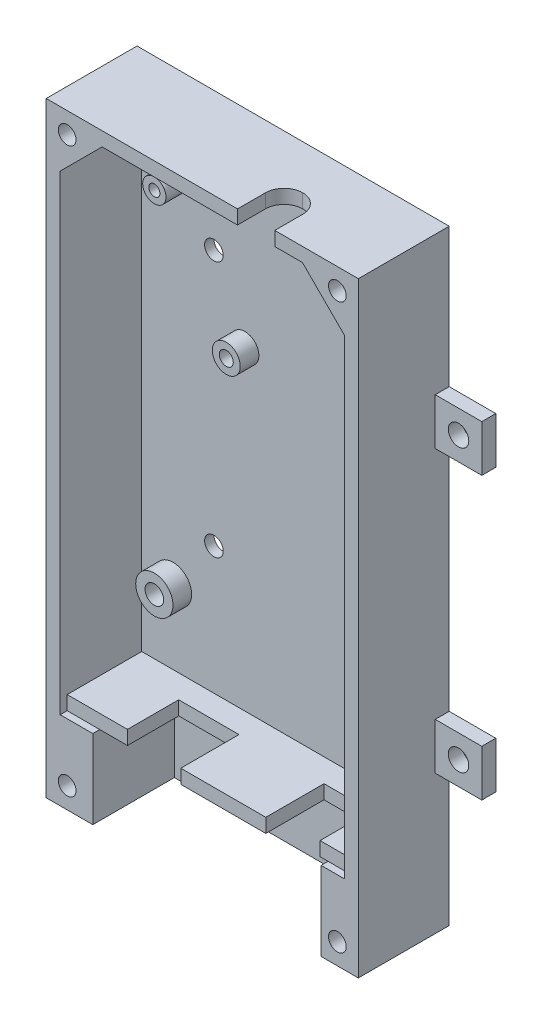
from build123d import *

# Parameters (mm, degrees)
SKETCH1_W           = 67
SKETCH1_H           = 130
BOSS_EXTRUDE1_DEPTH = 2
SKETCH2_W           = 18.2532
SKETCH2_H           = 3
BOSS_EXTRUDE2_DEPTH = 17.5
SKETCH3_R           = 3
SKETCH3_R_2         = 1.5
SKETCH3_R_3         = 2.5
SKETCH3_R_4         = 1.2
SKETCH3_R_5         = 4
SKETCH3_R_6         = 2
BOSS_EXTRUDE3_DEPTH = 4
SKETCH4_W           = 12.938
SKETCH4_H           = 3
SKETCH4_W_2         = 10.144
BOSS_EXTRUDE4_DEPTH = 5
SKETCH5_R           = 2
CUT_EXTRUDE1_DEPTH  = 201.297076365
SKETCH6_W           = 12.940950003
SKETCH6_H           = 3
CUT_EXTRUDE2_DEPTH  = 1.5
SKETCH7_W           = 10
SKETCH7_H           = 16.939031541
SKETCH7_W_2         = 8
BOSS_EXTRUDE5_DEPTH = 17.5
SKETCH8_W           = 6.723849997
SKETCH8_H           = 3
CUT_EXTRUDE3_DEPTH  = 1.5
CHAMFER1_SIZE       = 9
SKETCH10_R          = 1.9
CUT_EXTRUDE4_DEPTH  = 201.481716873
SKETCH11_R          = 2
CUT_EXTRUDE5_DEPTH  = 201.297076365
SKETCH13_W          = 8
SKETCH13_H          = 3
CUT_EXTRUDE6_DEPTH  = 10
FILLET1_R           = 4
SKETCH14_W          = 10
SKETCH14_H          = 10
SKETCH14_R          = 2.2
BOSS_EXTRUDE6_DEPTH = 3
SKETCH15_R          = 1.2
SKETCH15_R_2        = 1.5
CUT_EXTRUDE7_DEPTH  = 203.281693166


with BuildPart() as part:
    # Sketch1 → Boss-Extrude1 (new body)
    with BuildSketch(Plane.XY):
        with Locations((1.448229487, -131.44665957)):
            Rectangle(SKETCH1_W, SKETCH1_H)
    extrude(amount=-BOSS_EXTRUDE1_DEPTH)

    # Sketch2 → Boss-Extrude2 (add)
    with BuildSketch(Plane.XY):
        Polygon((-32.051770513, -66.44665957), (34.948229487, -66.44665957), (34.948229487, -179.507628029), (25.22437949, -179.507628029), (25.22437949, -176.507628029), (31.948229487, -176.507628029), (31.948229487, -69.44665957), (-29.051770513, -69.44665957), (-29.051770513, -176.507628029), (-16.11082051, -176.507628029), (-16.11082051, -179.507628029), (-32.051770513, -179.507628029), align=None)
        with Locations((5.95377949, -178.007628029)):
            Rectangle(SKETCH2_W, SKETCH2_H)
    extrude(amount=BOSS_EXTRUDE2_DEPTH)

    # Sketch3 → Boss-Extrude3 (add)
    # profile 1 of 5: a face of its own
    with BuildSketch(Plane.XY):
        with Locations(Location((-6.90031328, -108.930928029, 0), (0, 0, 180))):
            Circle(SKETCH3_R)
        with Locations(Location((-6.90031328, -108.930928029, 0), (0, 0, 180))):
            Circle(SKETCH3_R_2, mode=Mode.SUBTRACT)
    # profile 2 of 5: a face of its own
    with BuildSketch(Plane.XY):
        with Locations(Location((-22.341820513, -85.423228029, 0), (0, 0, 180))):
            Circle(SKETCH3_R_3)
        with Locations(Location((-22.341820513, -85.423228029, 0), (0, 0, 180))):
            Circle(SKETCH3_R_4, mode=Mode.SUBTRACT)
    # profile 3 of 5: a face of its own
    with BuildSketch(Plane.XY):
        with Locations(Location((25.994379487, -77.930228029, 0), (0, 0, 180))):
            Circle(SKETCH3_R_3)
        with Locations(Location((25.994379487, -77.930228029, 0), (0, 0, 180))):
            Circle(SKETCH3_R_4, mode=Mode.SUBTRACT)
    # profile 4 of 5: a face of its own
    with BuildSketch(Plane.XY):
        with Locations(Location((25.994379487, -160.556428029, 0), (0, 0, 180))):
            Circle(SKETCH3_R_3)
        with Locations(Location((25.994379487, -160.556428029, 0), (0, 0, 180))):
            Circle(SKETCH3_R_4, mode=Mode.SUBTRACT)
    # profile 5 of 5: a face of its own
    with BuildSketch(Plane.XY):
        with Locations(Location((-22.341820513, -160.556428029, 0), (0, 0, 180))):
            Circle(SKETCH3_R_5)
        with Locations(Location((-22.341820513, -160.556428029, 0), (0, 0, 180))):
            Circle(SKETCH3_R_6, mode=Mode.SUBTRACT)
    extrude(amount=BOSS_EXTRUDE3_DEPTH)

    # Sketch4 → Boss-Extrude4 (add)
    with BuildSketch(Plane.XY):
        with Locations((-9.64182051, -178.007628029)):
            Rectangle(SKETCH4_W, SKETCH4_H)
        with Locations((20.15237949, -178.007628029)):
            Rectangle(SKETCH4_W_2, SKETCH4_H)
    extrude(amount=BOSS_EXTRUDE4_DEPTH)

    # Sketch5 → Cut-Extrude1 (cut, through all)
    with BuildSketch(Plane.XY):
        with Locations((-13.551770513, -94.136094707)):
            Circle(SKETCH5_R)
        with Locations((16.448229487, -94.136094707)):
            Circle(SKETCH5_R)
        with Locations((-13.551770513, -149.136094707)):
            Circle(SKETCH5_R)
        with Locations((16.448229487, -149.136094707)):
            Circle(SKETCH5_R)
    extrude(amount=-CUT_EXTRUDE1_DEPTH, mode=Mode.SUBTRACT)

    # Sketch6 → Cut-Extrude2 (cut)
    with BuildSketch(Plane.XY.offset(17.5)):
        with Locations((-22.581295512, -178.007628029)):
            Rectangle(SKETCH6_W, SKETCH6_H)
    extrude(amount=-CUT_EXTRUDE2_DEPTH, mode=Mode.SUBTRACT)

    # Sketch7 → Boss-Extrude5 (add)
    with BuildSketch(Plane.XY):
        with Locations((-27.051770513, -187.9771438)):
            Rectangle(SKETCH7_W, SKETCH7_H)
        with Locations((30.948229487, -187.9771438)):
            Rectangle(SKETCH7_W_2, SKETCH7_H)
    extrude(amount=BOSS_EXTRUDE5_DEPTH)

    # Sketch8 → Cut-Extrude3 (cut)
    with BuildSketch(Plane.XY.offset(17.5)):
        with Locations((28.586304489, -178.007628029)):
            Rectangle(SKETCH8_W, SKETCH8_H)
    extrude(amount=-CUT_EXTRUDE3_DEPTH, mode=Mode.SUBTRACT)

    # Chamfer1
    chamfer1_edges = [part.edges().sort_by_distance(p)[0] for p in [
        (-29.051770513, -69.44665957, 8.75),
        (31.948229487, -69.44665957, 8.75),
    ]]
    chamfer(chamfer1_edges, length=CHAMFER1_SIZE)

    # Sketch10 → Cut-Extrude4 (cut, through all)
    with BuildSketch(Plane.XY.offset(17.5)):
        with Locations((-27.551770513, -70.94665957)):
            Circle(SKETCH10_R)
        with Locations(Location((30.448229487, -70.94665957, 0), (0, 0, 180))):
            Circle(SKETCH10_R)
        with Locations((-27.551770513, -191.94665957)):
            Circle(SKETCH10_R)
        with Locations((30.448229487, -191.94665957)):
            Circle(SKETCH10_R)
    extrude(amount=-CUT_EXTRUDE4_DEPTH, mode=Mode.SUBTRACT)

    # Sketch11 → Cut-Extrude5 (cut, through all)
    with BuildSketch(Plane.XY):
        with Locations(Location((-22.341820513, -160.556428029, 0), (0, 0, 180))):
            Circle(SKETCH11_R)
    extrude(amount=-CUT_EXTRUDE5_DEPTH, mode=Mode.SUBTRACT)

    # Sketch13 → Cut-Extrude6 (cut)
    with BuildSketch(Plane.XY.offset(17.5)):
        with Locations((13.007373808, -67.94665957)):
            Rectangle(SKETCH13_W, SKETCH13_H)
    extrude(amount=-CUT_EXTRUDE6_DEPTH, mode=Mode.SUBTRACT)

    # Fillet1
    fillet1_edges = [part.edges().sort_by_distance(p)[0] for p in [
        (17.007373808, -67.94665957, 7.5),
        (9.007373808, -67.94665957, 7.5),
    ]]
    fillet(fillet1_edges, radius=FILLET1_R - 0.0001)  # a hair under: the kernel refuses the full size

    # Sketch14 → Boss-Extrude6 (add)
    # profile 1 of 4: a face of its own
    with BuildSketch(Plane(origin=(0, 0, -2), x_dir=(-1, 0, 0), z_dir=(0, 0, -1))):
        with Locations((37.051770513, -101.268546353)):
            Rectangle(SKETCH14_W, SKETCH14_H)
        with Locations((37.051770513, -101.268546353)):
            Circle(SKETCH14_R, mode=Mode.SUBTRACT)
    # profile 2 of 4: a face of its own
    with BuildSketch(Plane(origin=(0, 0, -2), x_dir=(-1, 0, 0), z_dir=(0, 0, -1))):
        with Locations((-39.948229487, -101.268546353)):
            Rectangle(SKETCH14_W, SKETCH14_H)
        with Locations(Location((-39.948229487, -101.268546353, 0), (0, 0, 180))):
            Circle(SKETCH14_R, mode=Mode.SUBTRACT)
    # profile 3 of 4: a face of its own
    with BuildSketch(Plane(origin=(0, 0, -2), x_dir=(-1, 0, 0), z_dir=(0, 0, -1))):
        with Locations((-39.948229487, -161.624772787)):
            Rectangle(SKETCH14_W, SKETCH14_H)
        with Locations((-39.948229487, -161.624772787)):
            Circle(SKETCH14_R, mode=Mode.SUBTRACT)
    # profile 4 of 4: a face of its own
    with BuildSketch(Plane(origin=(0, 0, -2), x_dir=(-1, 0, 0), z_dir=(0, 0, -1))):
        with Locations((37.051770513, -161.624772787)):
            Rectangle(SKETCH14_W, SKETCH14_H)
        with Locations(Location((37.051770513, -161.624772787, 0), (0, 0, 180))):
            Circle(SKETCH14_R, mode=Mode.SUBTRACT)
    extrude(amount=-BOSS_EXTRUDE6_DEPTH)

    # Sketch15 → Cut-Extrude7 (cut, through all)
    with BuildSketch(Plane.XY):
        with Locations(Location((-22.341820513, -85.423228029, 0), (0, 0, 180))):
            Circle(SKETCH15_R)
        with Locations(Location((25.994379487, -77.930228029, 0), (0, 0, 180))):
            Circle(SKETCH15_R)
        with Locations(Location((-6.90031328, -108.930928029, 0), (0, 0, 180))):
            Circle(SKETCH15_R_2)
        with Locations(Location((25.994379487, -160.556428029, 0), (0, 0, 180))):
            Circle(SKETCH15_R)
    extrude(amount=-CUT_EXTRUDE7_DEPTH, mode=Mode.SUBTRACT)


solid = part.part
